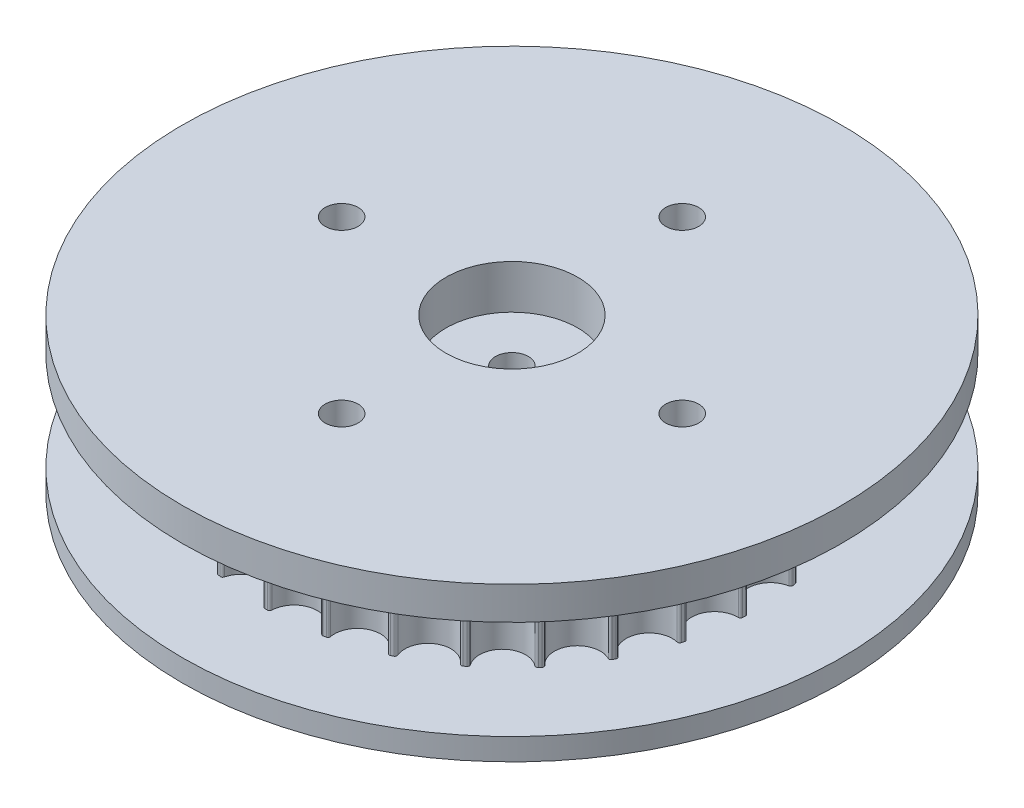
from build123d import *

# Parameters (mm, degrees)
SKETCH1_R           = 30
SKETCH1_R_2         = 1.5
BOSS_EXTRUDE1_DEPTH = 2
SKETCH2_R           = 1.5
BOSS_EXTRUDE2_DEPTH = 9
SKETCH3_R           = 30
SKETCH3_R_2         = 1.5
BOSS_EXTRUDE3_DEPTH = 3
SKETCH4_R           = 6
CUT_EXTRUDE1_DEPTH  = 4
SKETCH5_R           = 1.5
CUT_EXTRUDE2_DEPTH  = 45.09081537


with BuildPart() as part:
    # Sketch1 → Boss-Extrude1 (new body)
    with BuildSketch(Plane(origin=(0, 0, 0), x_dir=(1, 0, 0), z_dir=(0, 1, 0))):
        Circle(SKETCH1_R)
        with Locations((0, 15.5)):
            Circle(SKETCH1_R_2, mode=Mode.SUBTRACT)
        with Locations((15.5, 0)):
            Circle(SKETCH1_R_2, mode=Mode.SUBTRACT)
        with Locations((0, -15.5)):
            Circle(SKETCH1_R_2, mode=Mode.SUBTRACT)
        with Locations((-15.5, 0)):
            Circle(SKETCH1_R_2, mode=Mode.SUBTRACT)
        Circle(SKETCH1_R_2, mode=Mode.SUBTRACT)
    extrude(amount=BOSS_EXTRUDE1_DEPTH)

    # Sketch2 → Boss-Extrude2 (add)
    with BuildSketch(Plane(origin=(0, 2, 0), x_dir=(1, 0, 0), z_dir=(0, 1, 0))):
        with BuildLine():
            Line((2.298551641, 22.254277442), (2.539199037, 22.228105461))
            ThreePointArc((2.539199037, 22.228105461), (2.670825131, 22.156613046), (2.715887922, 22.013763689))
            ThreePointArc((2.715887922, 22.013763689), (4.358024031, 19.798702775), (6.778466337, 21.119522558))
            ThreePointArc((6.778466337, 21.119522558), (6.879345106, 21.230247749), (7.028824599, 21.239864144))
            Line((7.028824599, 21.239864144), (7.258219591, 21.162571972))
            ThreePointArc((7.258219591, 21.162571972), (7.371399584, 21.064455292), (7.384700443, 20.915258505))
            ThreePointArc((7.384700443, 20.915258505), (8.512271702, 18.398973762), (11.160062622, 19.168589965))
            ThreePointArc((11.160062622, 19.168589965), (11.282385545, 19.255040508), (11.430437531, 19.232298406))
            Line((11.430437531, 19.232298406), (11.637853863, 19.107500139))
            ThreePointArc((11.637853863, 19.107500139), (11.727295585, 18.987347019), (11.708212578, 18.838779079))
            ThreePointArc((11.708212578, 18.838779079), (12.268495009, 16.138929185), (15.019826783, 16.321355409))
            ThreePointArc((15.019826783, 16.321355409), (15.157874175, 16.379488974), (15.297575908, 16.325451769))
            Line((15.297575908, 16.325451769), (15.473315023, 16.158982836))
            ThreePointArc((15.473315023, 16.158982836), (15.534836278, 16.022411503), (15.484261706, 15.881419281))
            ThreePointArc((15.484261706, 15.881419281), (15.451057125, 13.124246216), (18.177280536, 12.710952414))
            ThreePointArc((18.177280536, 12.710952414), (18.324597455, 12.73805074), (18.449416638, 12.655245151))
            Line((18.449416638, 12.655245151), (18.585261171, 12.454889455))
            ThreePointArc((18.585261171, 12.454889455), (18.615985293, 12.308285833), (18.536283966, 12.181461969))
            ThreePointArc((18.536283966, 12.181461969), (17.911144982, 9.495888081), (20.484784855, 8.506199412))
            ThreePointArc((20.484784855, 8.506199412), (20.634482925, 8.500995411), (20.738583151, 8.393293336))
            Line((20.738583151, 8.393293336), (20.828181161, 8.168419286))
            ThreePointArc((20.828181161, 8.168419286), (20.826671525, 8.018638396), (20.72157019, 7.911913033))
            ThreePointArc((20.72157019, 7.911913033), (19.533727607, 5.423512773), (21.834443401, 3.903705978))
            ThreePointArc((21.834443401, 3.903705978), (21.979522907, 3.866442984), (22.058036564, 3.738880453))
            Line((22.058036564, 3.738880453), (22.09719855, 3.500002909))
            ThreePointArc((22.09719855, 3.500002909), (22.063525745, 3.354048341), (21.937938822, 3.272411838))
            ThreePointArc((21.937938822, 3.272411838), (20.242934839, 1.097540036), (22.16314764, -0.881320408))
            ThreePointArc((22.16314764, -0.881320408), (22.296824826, -0.948900019), (22.346080704, -1.090358325))
            Line((22.346080704, -1.090358325), (22.332975494, -1.332069714))
            ThreePointArc((22.332975494, -1.332069714), (22.268714022, -1.467373288), (22.128513816, -1.520103698))
            ThreePointArc((22.128513816, -1.520103698), (20.005604936, -3.279752454), (21.455527729, -5.625137231))
            ThreePointArc((21.455527729, -5.625137231), (21.571551997, -5.719873512), (21.589246946, -5.868613159))
            Line((21.589246946, -5.868613159), (21.524487324, -6.101856237))
            ThreePointArc((21.524487324, -6.101856237), (21.432641981, -6.220182172), (21.284384099, -6.241540875))
            ThreePointArc((21.284384099, -6.241540875), (18.832835181, -7.503687364), (19.744671187, -10.105928889))
            ThreePointArc((19.744671187, -10.105928889), (19.837617372, -10.223392077), (19.822923996, -10.372458165))
            Line((19.822923996, -10.372458165), (19.709538051, -10.586326745))
            ThreePointArc((19.709538051, -10.586326745), (19.594403423, -10.682142251), (19.445020237, -10.671130537))
            ThreePointArc((19.445020237, -10.671130537), (16.779462985, -11.376758193), (17.110575765, -14.114178544))
            ThreePointArc((17.110575765, -14.114178544), (17.176097807, -14.24887619), (17.129703151, -14.391298554))
            Line((17.129703151, -14.391298554), (16.972992683, -14.575792379))
            ThreePointArc((16.972992683, -14.575792379), (16.839952337, -14.644617231), (16.696428841, -14.601749996))
            ThreePointArc((16.696428841, -14.601749996), (13.941501748, -14.717864453), (13.676408837, -17.462464898))
            ThreePointArc((13.676408837, -17.462464898), (13.711442998, -17.60809869), (13.635516425, -17.737217819))
            Line((13.635516425, -17.737217819), (13.442809042, -17.883710162))
            ThreePointArc((13.442809042, -17.883710162), (13.298083797, -17.922326185), (13.167130989, -17.849607853))
            ThreePointArc((13.167130989, -17.849607853), (10.451651384, -17.370779728), (9.602748232, -19.994225801))
            ThreePointArc((9.602748232, -19.994225801), (9.605656353, -20.143986065), (9.503748106, -20.253764491))
            Line((9.503748106, -20.253764491), (9.284054591, -20.355405534))
            ThreePointArc((9.284054591, -20.355405534), (9.134411638, -20.362007086), (9.022152725, -20.262837886))
            ThreePointArc((9.022152725, -20.262837886), (6.473093418, -19.21145665), (5.080073793, -21.591078927))
            ThreePointArc((5.080073793, -21.591078927), (5.050719894, -21.73796304), (4.927595088, -21.823267646))
            Line((4.927595088, -21.823267646), (4.691188066, -21.875304767))
            ThreePointArc((4.691188066, -21.875304767), (4.543624543, -21.849583167), (4.455308628, -21.728600139))
            ThreePointArc((4.455308628, -21.728600139), (2.191860797, -20.153827211), (0.319860749, -22.1783572))
            ThreePointArc((0.319860749, -22.1783572), (0.259617386, -22.315497023), (0.1210332, -22.372339061))
            Line((0.1210332, -22.372339061), (-0.1210332, -22.372339061))
            ThreePointArc((-0.1210332, -22.372339061), (-0.259617386, -22.315497023), (-0.319860749, -22.1783572))
            ThreePointArc((-0.319860749, -22.1783572), (-2.191860797, -20.153827211), (-4.455308628, -21.728600139))
            ThreePointArc((-4.455308628, -21.728600139), (-4.543624543, -21.849583167), (-4.691188066, -21.875304767))
            Line((-4.691188066, -21.875304767), (-4.927595088, -21.823267646))
            ThreePointArc((-4.927595088, -21.823267646), (-5.050719894, -21.73796304), (-5.080073793, -21.591078927))
            ThreePointArc((-5.080073793, -21.591078927), (-6.473093418, -19.21145665), (-9.022152725, -20.262837886))
            ThreePointArc((-9.022152725, -20.262837886), (-9.134411638, -20.362007086), (-9.284054591, -20.355405534))
            Line((-9.284054591, -20.355405534), (-9.503748106, -20.253764491))
            ThreePointArc((-9.503748106, -20.253764491), (-9.605656353, -20.143986065), (-9.602748232, -19.994225801))
            ThreePointArc((-9.602748232, -19.994225801), (-10.451651384, -17.370779728), (-13.167130989, -17.849607853))
            ThreePointArc((-13.167130989, -17.849607853), (-13.298083797, -17.922326185), (-13.442809042, -17.883710162))
            Line((-13.442809042, -17.883710162), (-13.635516425, -17.737217819))
            ThreePointArc((-13.635516425, -17.737217819), (-13.711442998, -17.60809869), (-13.676408837, -17.462464898))
            ThreePointArc((-13.676408837, -17.462464898), (-13.941501748, -14.717864453), (-16.696428841, -14.601749996))
            ThreePointArc((-16.696428841, -14.601749996), (-16.839952337, -14.644617231), (-16.972992683, -14.575792379))
            Line((-16.972992683, -14.575792379), (-17.129703151, -14.391298554))
            ThreePointArc((-17.129703151, -14.391298554), (-17.176097807, -14.24887619), (-17.110575765, -14.114178544))
            ThreePointArc((-17.110575765, -14.114178544), (-16.779462985, -11.376758193), (-19.445020237, -10.671130537))
            ThreePointArc((-19.445020237, -10.671130537), (-19.594403423, -10.682142251), (-19.709538051, -10.586326745))
            Line((-19.709538051, -10.586326745), (-19.822923996, -10.372458165))
            ThreePointArc((-19.822923996, -10.372458165), (-19.837617372, -10.223392077), (-19.744671187, -10.105928889))
            ThreePointArc((-19.744671187, -10.105928889), (-18.832835181, -7.503687364), (-21.284384099, -6.241540875))
            ThreePointArc((-21.284384099, -6.241540875), (-21.432641981, -6.220182172), (-21.524487324, -6.101856237))
            Line((-21.524487324, -6.101856237), (-21.589246946, -5.868613159))
            ThreePointArc((-21.589246946, -5.868613159), (-21.571551997, -5.719873512), (-21.455527729, -5.625137231))
            ThreePointArc((-21.455527729, -5.625137231), (-20.005604936, -3.279752454), (-22.128513816, -1.520103698))
            ThreePointArc((-22.128513816, -1.520103698), (-22.268714022, -1.467373288), (-22.332975494, -1.332069714))
            Line((-22.332975494, -1.332069714), (-22.346080704, -1.090358325))
            ThreePointArc((-22.346080704, -1.090358325), (-22.296824826, -0.948900019), (-22.16314764, -0.881320408))
            ThreePointArc((-22.16314764, -0.881320408), (-20.242934839, 1.097540036), (-21.937938822, 3.272411838))
            ThreePointArc((-21.937938822, 3.272411838), (-22.063525745, 3.354048341), (-22.09719855, 3.500002909))
            Line((-22.09719855, 3.500002909), (-22.058036564, 3.738880453))
            ThreePointArc((-22.058036564, 3.738880453), (-21.979522907, 3.866442984), (-21.834443401, 3.903705978))
            ThreePointArc((-21.834443401, 3.903705978), (-19.533727607, 5.423512773), (-20.72157019, 7.911913033))
            ThreePointArc((-20.72157019, 7.911913033), (-20.826671525, 8.018638396), (-20.828181161, 8.168419286))
            Line((-20.828181161, 8.168419286), (-20.738583151, 8.393293336))
            ThreePointArc((-20.738583151, 8.393293336), (-20.634482925, 8.500995411), (-20.484784855, 8.506199412))
            ThreePointArc((-20.484784855, 8.506199412), (-17.911144982, 9.495888081), (-18.536283966, 12.181461969))
            ThreePointArc((-18.536283966, 12.181461969), (-18.615985293, 12.308285833), (-18.585261171, 12.454889455))
            Line((-18.585261171, 12.454889455), (-18.449416638, 12.655245151))
            ThreePointArc((-18.449416638, 12.655245151), (-18.324597455, 12.73805074), (-18.177280536, 12.710952414))
            ThreePointArc((-18.177280536, 12.710952414), (-15.451057125, 13.124246216), (-15.484261706, 15.881419281))
            ThreePointArc((-15.484261706, 15.881419281), (-15.534836278, 16.022411503), (-15.473315023, 16.158982836))
            Line((-15.473315023, 16.158982836), (-15.297575908, 16.325451769))
            ThreePointArc((-15.297575908, 16.325451769), (-15.157874175, 16.379488974), (-15.019826783, 16.321355409))
            ThreePointArc((-15.019826783, 16.321355409), (-12.268495009, 16.138929185), (-11.708212578, 18.838779079))
            ThreePointArc((-11.708212578, 18.838779079), (-11.727295585, 18.987347019), (-11.637853863, 19.107500139))
            Line((-11.637853863, 19.107500139), (-11.430437531, 19.232298406))
            ThreePointArc((-11.430437531, 19.232298406), (-11.282385545, 19.255040508), (-11.160062622, 19.168589965))
            ThreePointArc((-11.160062622, 19.168589965), (-8.512271702, 18.398973762), (-7.384700443, 20.915258505))
            ThreePointArc((-7.384700443, 20.915258505), (-7.371399584, 21.064455292), (-7.258219591, 21.162571972))
            Line((-7.258219591, 21.162571972), (-7.028824599, 21.239864144))
            ThreePointArc((-7.028824599, 21.239864144), (-6.879345106, 21.230247749), (-6.778466337, 21.119522558))
            ThreePointArc((-6.778466337, 21.119522558), (-4.358024031, 19.798702775), (-2.715887922, 22.013763689))
            ThreePointArc((-2.715887922, 22.013763689), (-2.670825131, 22.156613046), (-2.539199037, 22.228105461))
            Line((-2.539199037, 22.228105461), (-2.298551641, 22.254277442))
            ThreePointArc((-2.298551641, 22.254277442), (-2.154634136, 22.2127522), (-2.079916499, 22.08292975))
            ThreePointArc((-2.079916499, 22.08292975), (0, 20.272666451), (2.079916499, 22.08292975))
            ThreePointArc((2.079916499, 22.08292975), (2.154634136, 22.2127522), (2.298551641, 22.254277442))
        make_face()
        with Locations((0, 15.5)):
            Circle(SKETCH2_R, mode=Mode.SUBTRACT)
        with Locations((15.5, 0)):
            Circle(SKETCH2_R, mode=Mode.SUBTRACT)
        with Locations((0, -15.5)):
            Circle(SKETCH2_R, mode=Mode.SUBTRACT)
        with Locations((-15.5, 0)):
            Circle(SKETCH2_R, mode=Mode.SUBTRACT)
    extrude(amount=BOSS_EXTRUDE2_DEPTH)

    # Sketch3 → Boss-Extrude3 (add)
    with BuildSketch(Plane(origin=(0, 11, 0), x_dir=(1, 0, 0), z_dir=(0, 1, 0))):
        Circle(SKETCH3_R)
        with Locations((0, 15.5)):
            Circle(SKETCH3_R_2, mode=Mode.SUBTRACT)
        with Locations((15.5, 0)):
            Circle(SKETCH3_R_2, mode=Mode.SUBTRACT)
        with Locations((0, -15.5)):
            Circle(SKETCH3_R_2, mode=Mode.SUBTRACT)
        with Locations((-15.5, 0)):
            Circle(SKETCH3_R_2, mode=Mode.SUBTRACT)
    extrude(amount=BOSS_EXTRUDE3_DEPTH)

    # Sketch4 → Cut-Extrude1 (cut)
    with BuildSketch(Plane(origin=(0, 14, 0), x_dir=(1, 0, 0), z_dir=(0, 1, 0))):
        Circle(SKETCH4_R)
    extrude(amount=-CUT_EXTRUDE1_DEPTH, mode=Mode.SUBTRACT)

    # Sketch5 → Cut-Extrude2 (cut, through all)
    with BuildSketch(Plane.XZ.offset(-2)):
        Circle(SKETCH5_R)
    extrude(amount=-CUT_EXTRUDE2_DEPTH, mode=Mode.SUBTRACT)


solid = part.part
